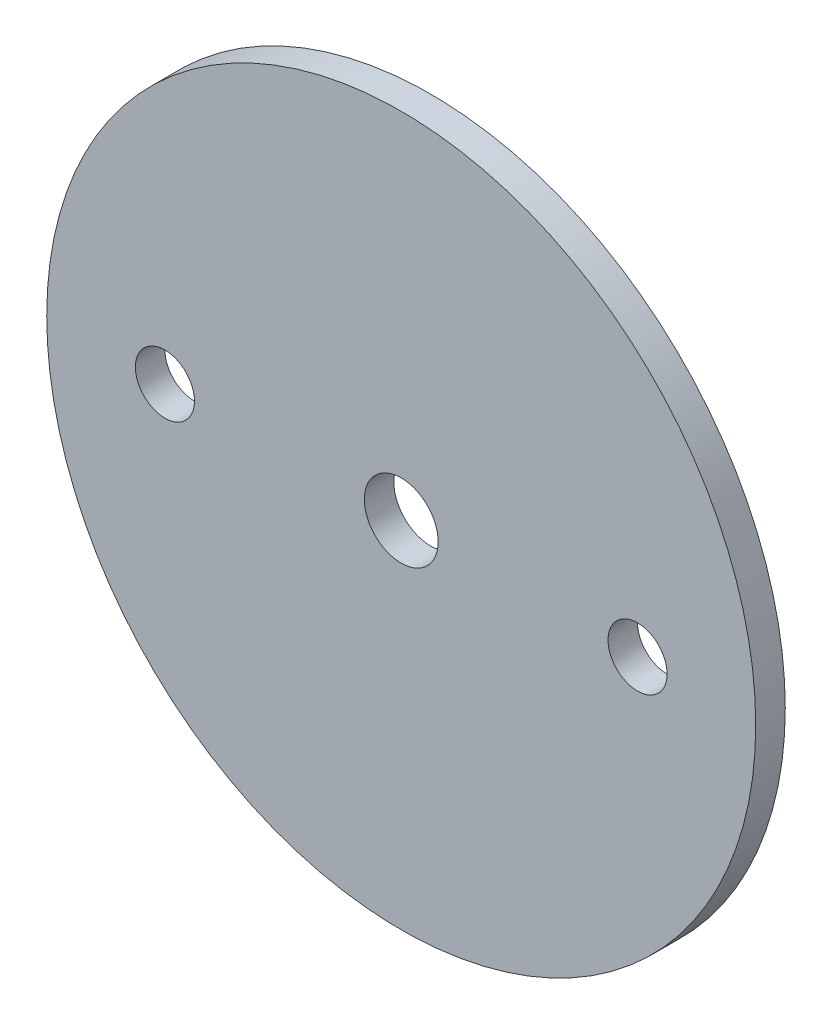
from build123d import *

# Parameters (mm, degrees)
SKETCH1_R                          = 38.1
BOSS_EXTRUDE1_DEPTH                = 1.5875
F_1_4_0_25_DIAMETER_HOLE1_D        = 6.35
F_5_16_0_3125_DIAMETER_HOLE1_D     = 7.9375
F_5_16_0_3125_DIAMETER_HOLE1_DEPTH = 3.302


with BuildPart() as part:
    # Sketch1 → Boss-Extrude1 (new, symmetric)
    with BuildSketch(Plane.XY):
        Circle(SKETCH1_R)
    extrude(amount=BOSS_EXTRUDE1_DEPTH, both=True)

    # 1/4 (0.25) Diameter Hole1 (through all)
    with Locations(Plane.XY.offset(1.5875)):
        with Locations((-25.4, 0), (25.4, 0)):
            Hole(F_1_4_0_25_DIAMETER_HOLE1_D / 2)

    # 5/16 (0.3125) Diameter Hole1
    with Locations(Plane.XY.offset(1.5875)):
        with Locations((0, 0)):
            Hole(F_5_16_0_3125_DIAMETER_HOLE1_D / 2, depth=F_5_16_0_3125_DIAMETER_HOLE1_DEPTH)


solid = part.part
